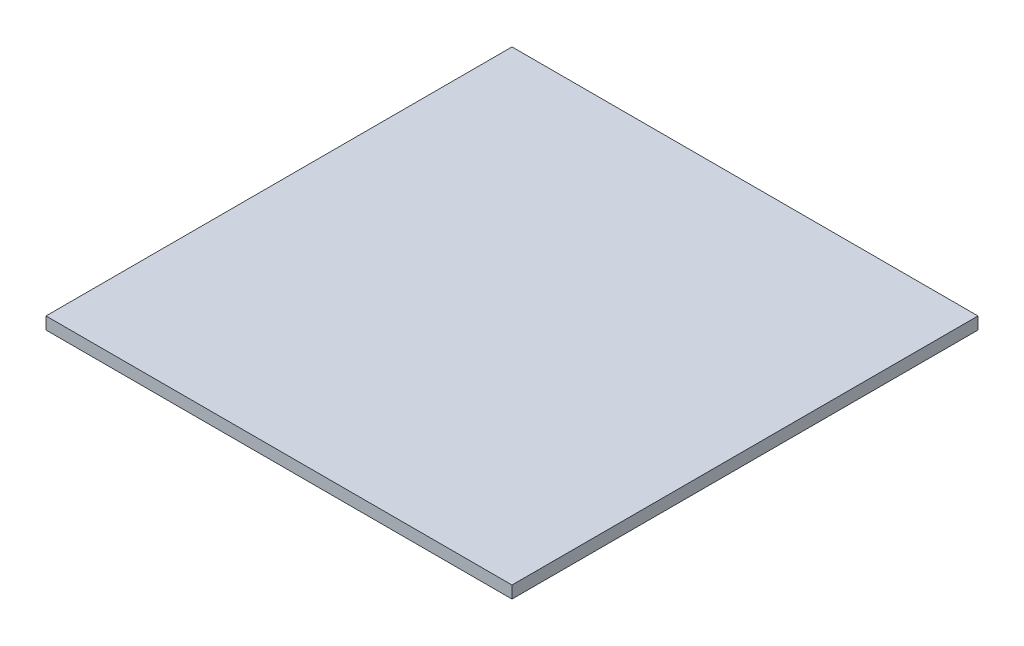
from build123d import *

# Parameters (mm, degrees)
SKETCH1_W           = 76.2
SKETCH1_H           = 76.2
BOSS_EXTRUDE1_DEPTH = 2


with BuildPart() as part:
    # Sketch1 → Boss-Extrude1 (new body)
    with BuildSketch(Plane(origin=(0, 0, 0), x_dir=(1, 0, 0), z_dir=(0, 1, 0))):
        Rectangle(SKETCH1_W, SKETCH1_H)
    extrude(amount=BOSS_EXTRUDE1_DEPTH)


solid = part.part
